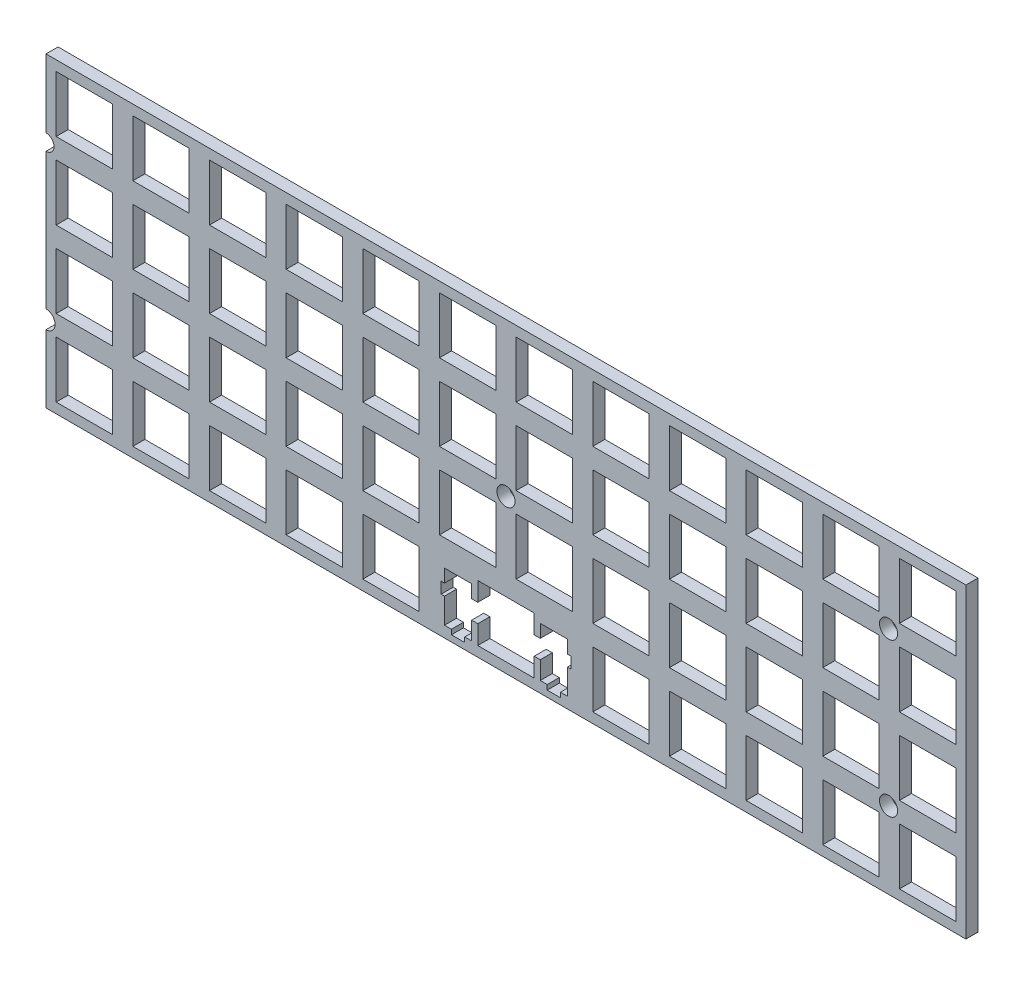
from build123d import *

# Parameters (mm, degrees)
MODEL_W             = 228.5999154
MODEL_H             = 76.199807
MODEL_W_2           = 13.99955
MODEL_H_2           = 13.99946
MODEL_W_3           = 13.9993
MODEL_W_4           = 13.999
MODEL_H_3           = 13.9994
MODEL_W_5           = 14.0007
MODEL_W_6           = 14.001
MODEL_H_4           = 13.9993
BOSS_EXTRUDE1_DEPTH = 3
SKETCH1_R           = 2.25
CUT_EXTRUDE1_DEPTH  = 242.155867296


with BuildPart() as part:
    # Model → Boss-Extrude1 (new body)
    with BuildSketch(Plane.XY):
        with Locations((114.3950423, 38.3575965)):
            Rectangle(MODEL_W, MODEL_H)
        Polygon((107.395, 16.7831), (107.395, 12.0826), (105.869, 12.0826), (105.869, 15.3128), (99.1182, 15.3128), (99.1182, 12.0826), (98.2941, 12.0826), (98.2941, 9.28384), (99.1182, 9.28384), (99.1182, 3.01377), (100.845, 3.01377), (100.845, 1.8135), (104.144, 1.8135), (104.144, 3.01377), (105.869, 3.01377), (105.869, 7.48273), (107.395, 7.48273), (107.395, 2.78364), (121.394, 2.78364), (121.394, 7.48273), (122.92, 7.48273), (122.92, 3.01377), (124.645, 3.01377), (124.645, 1.8135), (127.944, 1.8135), (127.944, 3.01377), (129.669, 3.01377), (129.669, 9.28384), (130.495, 9.28384), (130.495, 12.0826), (129.669, 12.0826), (129.669, 15.3128), (122.92, 15.3128), (122.92, 12.0826), (121.394, 12.0826), (121.394, 16.7831), align=None, mode=Mode.SUBTRACT)
        with Locations((9.619425, 9.78337)):
            Rectangle(MODEL_W_2, MODEL_H_2, mode=Mode.SUBTRACT)
        with Locations((28.66935, 9.78337)):
            Rectangle(MODEL_W_3, MODEL_H_2, mode=Mode.SUBTRACT)
        with Locations((47.71935, 9.78337)):
            Rectangle(MODEL_W_3, MODEL_H_2, mode=Mode.SUBTRACT)
        with Locations((66.76935, 9.78337)):
            Rectangle(MODEL_W_3, MODEL_H_2, mode=Mode.SUBTRACT)
        with Locations((85.81935, 9.78337)):
            Rectangle(MODEL_W_3, MODEL_H_2, mode=Mode.SUBTRACT)
        with Locations((142.9695, 9.78337)):
            Rectangle(MODEL_W_4, MODEL_H_2, mode=Mode.SUBTRACT)
        with Locations((162.0195, 9.78337)):
            Rectangle(MODEL_W_4, MODEL_H_2, mode=Mode.SUBTRACT)
        with Locations((181.0695, 9.78337)):
            Rectangle(MODEL_W_4, MODEL_H_2, mode=Mode.SUBTRACT)
        with Locations((200.1195, 9.78337)):
            Rectangle(MODEL_W_4, MODEL_H_2, mode=Mode.SUBTRACT)
        with Locations((219.1695, 9.78337)):
            Rectangle(MODEL_W_4, MODEL_H_2, mode=Mode.SUBTRACT)
        with Locations((9.619425, 28.8333)):
            Rectangle(MODEL_W_2, MODEL_H_3, mode=Mode.SUBTRACT)
        with Locations((28.66935, 28.8333)):
            Rectangle(MODEL_W_3, MODEL_H_3, mode=Mode.SUBTRACT)
        with Locations((47.71935, 28.8333)):
            Rectangle(MODEL_W_3, MODEL_H_3, mode=Mode.SUBTRACT)
        with Locations((66.76935, 28.8333)):
            Rectangle(MODEL_W_3, MODEL_H_3, mode=Mode.SUBTRACT)
        with Locations((85.81935, 28.8333)):
            Rectangle(MODEL_W_3, MODEL_H_3, mode=Mode.SUBTRACT)
        with Locations((104.86865, 28.8333)):
            Rectangle(MODEL_W_5, MODEL_H_3, mode=Mode.SUBTRACT)
        with Locations((123.9185, 28.8333)):
            Rectangle(MODEL_W_6, MODEL_H_3, mode=Mode.SUBTRACT)
        with Locations((142.9695, 28.8333)):
            Rectangle(MODEL_W_4, MODEL_H_3, mode=Mode.SUBTRACT)
        with Locations((162.0195, 28.8333)):
            Rectangle(MODEL_W_4, MODEL_H_3, mode=Mode.SUBTRACT)
        with Locations((181.0695, 28.8333)):
            Rectangle(MODEL_W_4, MODEL_H_3, mode=Mode.SUBTRACT)
        with Locations((200.1195, 28.8333)):
            Rectangle(MODEL_W_4, MODEL_H_3, mode=Mode.SUBTRACT)
        with Locations((219.1695, 28.8333)):
            Rectangle(MODEL_W_4, MODEL_H_3, mode=Mode.SUBTRACT)
        with Locations((9.619425, 47.88345)):
            Rectangle(MODEL_W_2, MODEL_H_4, mode=Mode.SUBTRACT)
        with Locations((28.66935, 47.88345)):
            Rectangle(MODEL_W_3, MODEL_H_4, mode=Mode.SUBTRACT)
        with Locations((47.71935, 47.88345)):
            Rectangle(MODEL_W_3, MODEL_H_4, mode=Mode.SUBTRACT)
        with Locations((66.76935, 47.88345)):
            Rectangle(MODEL_W_3, MODEL_H_4, mode=Mode.SUBTRACT)
        with Locations((85.81935, 47.88345)):
            Rectangle(MODEL_W_3, MODEL_H_4, mode=Mode.SUBTRACT)
        with Locations((104.86865, 47.88345)):
            Rectangle(MODEL_W_5, MODEL_H_4, mode=Mode.SUBTRACT)
        with Locations((123.9185, 47.88345)):
            Rectangle(MODEL_W_6, MODEL_H_4, mode=Mode.SUBTRACT)
        with Locations((142.9695, 47.88345)):
            Rectangle(MODEL_W_4, MODEL_H_4, mode=Mode.SUBTRACT)
        with Locations((162.0195, 47.88345)):
            Rectangle(MODEL_W_4, MODEL_H_4, mode=Mode.SUBTRACT)
        with Locations((181.0695, 47.88345)):
            Rectangle(MODEL_W_4, MODEL_H_4, mode=Mode.SUBTRACT)
        with Locations((200.1195, 47.88345)):
            Rectangle(MODEL_W_4, MODEL_H_4, mode=Mode.SUBTRACT)
        with Locations((219.1695, 47.88345)):
            Rectangle(MODEL_W_4, MODEL_H_4, mode=Mode.SUBTRACT)
        with Locations((9.619425, 66.93345)):
            Rectangle(MODEL_W_2, MODEL_H_4, mode=Mode.SUBTRACT)
        with Locations((28.66935, 66.93345)):
            Rectangle(MODEL_W_3, MODEL_H_4, mode=Mode.SUBTRACT)
        with Locations((47.71935, 66.93345)):
            Rectangle(MODEL_W_3, MODEL_H_4, mode=Mode.SUBTRACT)
        with Locations((66.76935, 66.93345)):
            Rectangle(MODEL_W_3, MODEL_H_4, mode=Mode.SUBTRACT)
        with Locations((85.81935, 66.93345)):
            Rectangle(MODEL_W_3, MODEL_H_4, mode=Mode.SUBTRACT)
        with Locations((104.86865, 66.93345)):
            Rectangle(MODEL_W_5, MODEL_H_4, mode=Mode.SUBTRACT)
        with Locations((123.9185, 66.93345)):
            Rectangle(MODEL_W_6, MODEL_H_4, mode=Mode.SUBTRACT)
        with Locations((142.9695, 66.93345)):
            Rectangle(MODEL_W_4, MODEL_H_4, mode=Mode.SUBTRACT)
        with Locations((162.0195, 66.93345)):
            Rectangle(MODEL_W_4, MODEL_H_4, mode=Mode.SUBTRACT)
        with Locations((181.0695, 66.93345)):
            Rectangle(MODEL_W_4, MODEL_H_4, mode=Mode.SUBTRACT)
        with Locations((200.1195, 66.93345)):
            Rectangle(MODEL_W_4, MODEL_H_4, mode=Mode.SUBTRACT)
        with Locations((219.1695, 66.93345)):
            Rectangle(MODEL_W_4, MODEL_H_4, mode=Mode.SUBTRACT)
    extrude(amount=BOSS_EXTRUDE1_DEPTH)

    # Sketch1 → Cut-Extrude1 (cut, through all)
    with BuildSketch(Plane.XY.offset(3)):
        with Locations((114.394, 38.40099)):
            Circle(SKETCH1_R)
        with Locations((209.464, 57.45099)):
            Circle(SKETCH1_R)
        with Locations((209.464, 19.35099)):
            Circle(SKETCH1_R)
        with Locations((0.094, 19.35099)):
            Circle(SKETCH1_R)
        with BuildLine():
            Line((0.094, 59.45099), (0.094432, 55.500986))
            ThreePointArc((0.094432, 55.500986), (2.086578, 57.476205899), (0.094, 59.45099))
        make_face()
    extrude(amount=-CUT_EXTRUDE1_DEPTH, mode=Mode.SUBTRACT)


solid = part.part
